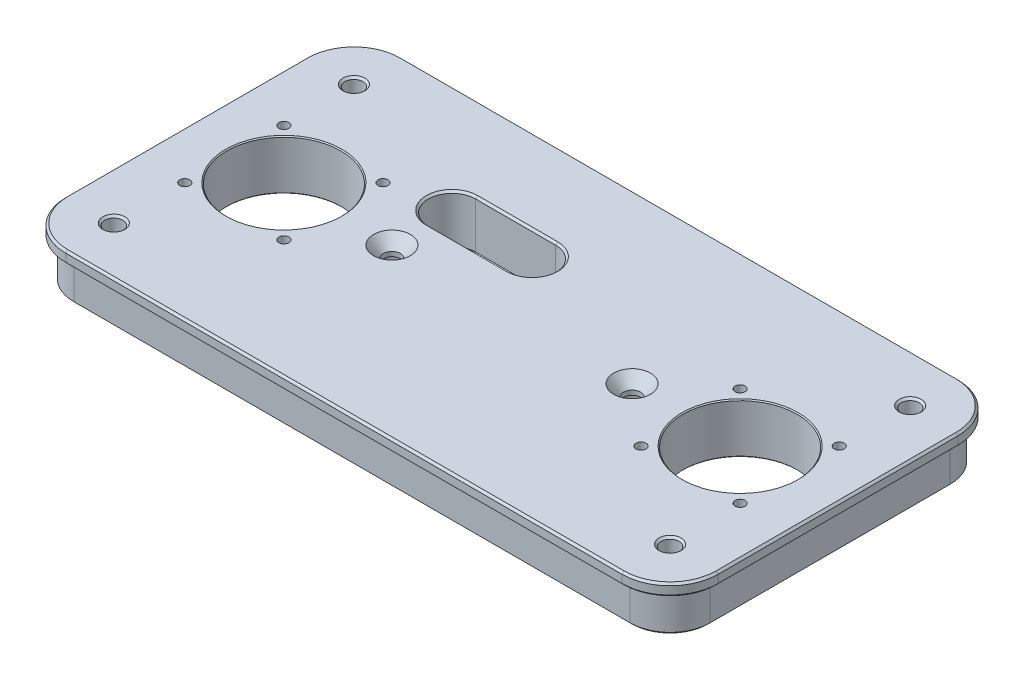
from build123d import *

# Parameters (mm, degrees)
SKETCH1_W                                            = 318
SKETCH1_H                                            = 160
BOSS_EXTRUDE1_DEPTH                                  = 25
SKETCH2_R                                            = 28.5
CUT_EXTRUDE1_DEPTH                                   = 180.738699228
CUT_EXTRUDE2_DEPTH                                   = 180.738699228
CUT_EXTRUDE2_DEPTH_BACK                              = 180.738699228
SKETCH4_R                                            = 9.55
CHAMFER1_SIZE                                        = 0.5
FILLET1_R                                            = 20
M8_CLEARANCE_HOLE1_D                                 = 9
M6X1_0_TAPPED_HOLE1_D                                = 5
SKETCH13_R                                           = 13.411040831
SKETCH13_R_2                                         = 14.724493856
BOSS_EXTRUDE3_DEPTH                                  = 8
CSK_FOR_5_16_FLAT_HEAD_SOCKET_CAP_SCREW1_D           = 8.4328
CSK_FOR_5_16_FLAT_HEAD_SOCKET_CAP_SCREW1_CSINK_D     = 18.4009792
CSK_FOR_5_16_FLAT_HEAD_SOCKET_CAP_SCREW1_CSINK_ANGLE = 82
BOSS_EXTRUDE4_DEPTH                                  = 6
CUT_EXTRUDE3_DEPTH                                   = 186.067555233
CHAMFER4_SIZE                                        = 1


with BuildPart() as part:
    # Sketch1 → Boss-Extrude1 (new body)
    with BuildSketch(Plane(origin=(0, 0, 0), x_dir=(1, 0, 0), z_dir=(0, 1, 0))):
        Rectangle(SKETCH1_W, SKETCH1_H)
    extrude(amount=BOSS_EXTRUDE1_DEPTH)

    # Sketch2 → Cut-Extrude1 (cut, through all)
    with BuildSketch(Plane(origin=(0, 25, 0), x_dir=(1, 0, 0), z_dir=(0, 1, 0))):
        with Locations((-114, 0)):
            Circle(SKETCH2_R)
        with Locations((114, 0)):
            Circle(SKETCH2_R)
    extrude(amount=-CUT_EXTRUDE1_DEPTH, mode=Mode.SUBTRACT)

    # Sketch4 → Cut-Extrude2 (cut, two sides: drawn at the far end of the back side and taken through both)
    with BuildSketch(Plane(origin=(0, 25, 0), x_dir=(1, 0, 0), z_dir=(0, 1, 0)).offset(-CUT_EXTRUDE2_DEPTH_BACK)):
        with Locations((-60, 0)):
            Circle(SKETCH4_R)
        with Locations((60, 0)):
            Circle(SKETCH4_R)
    extrude(amount=CUT_EXTRUDE2_DEPTH + CUT_EXTRUDE2_DEPTH_BACK, mode=Mode.SUBTRACT)

    # Chamfer1
    chamfer1_edges = [part.edges().sort_by_distance(p)[0] for p in [
        (85.5, 25, 0),
        (85.5, 0, 0),
        (50.45, 25, 0),
        (50.45, 0, 0),
        (-69.55, 25, 0),
        (-69.55, 0, 0),
        (-142.5, 25, 0),
        (-142.5, 0, 0),
    ]]
    chamfer(chamfer1_edges, length=CHAMFER1_SIZE)

    # Fillet1
    fillet1_edges = [part.edges().sort_by_distance(p)[0] for p in [
        (159, 12.5, 80),
        (159, 12.5, -80),
        (-159, 12.5, -80),
        (-159, 12.5, 80),
    ]]
    fillet(fillet1_edges, radius=FILLET1_R)

    # M8 Clearance Hole1 (through all)
    with Locations(Plane.XZ):
        with Locations((-139, -60), (-139, 60), (139, -60), (139, 60)):
            Hole(M8_CLEARANCE_HOLE1_D / 2)

    # M6x1.0 Tapped Hole1 (through all)
    with Locations(Plane(origin=(0, 0, 0), x_dir=(-1, 0, 0), z_dir=(0, -1, 0))):
        with Locations((138.765, -24.765), (89.235, -24.765), (89.235, 24.765), (138.765, 24.765), (-89.235, -24.765), (-138.765, -24.765), (-89.235, 24.765), (-138.765, 24.765)):
            Hole(M6X1_0_TAPPED_HOLE1_D / 2)

    # Sketch13 → Boss-Extrude3 (add)
    with BuildSketch(Plane(origin=(0, 25, 0), x_dir=(1, 0, 0), z_dir=(0, 1, 0))):
        with Locations((60, 0)):
            Circle(SKETCH13_R)
        with Locations((-60, 0)):
            Circle(SKETCH13_R_2)
    extrude(amount=-BOSS_EXTRUDE3_DEPTH)

    # CSK for 5/16 Flat Head Socket Cap Screw1 (through all)
    with Locations(Plane(origin=(0, 25, 0), x_dir=(1, 0, 0), z_dir=(0, 1, 0))):
        with Locations((60, 0), (-60, 0)):
            CounterSinkHole(CSK_FOR_5_16_FLAT_HEAD_SOCKET_CAP_SCREW1_D / 2, CSK_FOR_5_16_FLAT_HEAD_SOCKET_CAP_SCREW1_CSINK_D / 2, counter_sink_angle=CSK_FOR_5_16_FLAT_HEAD_SOCKET_CAP_SCREW1_CSINK_ANGLE)

    # Sketch16 → Boss-Extrude4 (add)
    with BuildSketch(Plane.XZ.offset(-25)):
        with BuildLine():
            Line((163, -60), (163, 60))
            ThreePointArc((163, 60), (155.970562748, 76.970562748), (139, 84))
            Line((139, 84), (-139, 84))
            ThreePointArc((-139, 84), (-155.970562748, 76.970562748), (-163, 60))
            Line((-163, 60), (-163, -60))
            ThreePointArc((-163, -60), (-155.970562748, -76.970562748), (-139, -84))
            Line((-139, -84), (139, -84))
            ThreePointArc((139, -84), (155.970562748, -76.970562748), (163, -60))
        make_face()
        with BuildLine():
            Line((159, 60), (159, -60))
            ThreePointArc((159, -60), (153.142135624, -74.142135624), (139, -80))
            Line((139, -80), (-139, -80))
            ThreePointArc((-139, -80), (-153.142135624, -74.142135624), (-159, -60))
            Line((-159, -60), (-159, 60))
            ThreePointArc((-159, 60), (-153.142135624, 74.142135624), (-139, 80))
            Line((-139, 80), (139, 80))
            ThreePointArc((139, 80), (153.142135624, 74.142135624), (159, 60))
        make_face(mode=Mode.SUBTRACT)
    extrude(amount=BOSS_EXTRUDE4_DEPTH)

    # Sketch17 → Cut-Extrude3 (cut, through all)
    with BuildSketch(Plane.XZ):
        with BuildLine():
            Line((-60, -18.184097247), (-20, -18.184097247))
            ThreePointArc((-20, -18.184097247), (-8.164859361, -30.019237886), (-20, -41.854378525))
            Line((-20, -41.854378525), (-60, -41.854378525))
            ThreePointArc((-60, -41.854378525), (-71.835140639, -30.019237886), (-60, -18.184097247))
        make_face()
    extrude(amount=-CUT_EXTRUDE3_DEPTH, mode=Mode.SUBTRACT)

    # Chamfer4
    chamfer4_edges = [part.edges().sort_by_distance(p)[0] for p in [
        (143.5, 0, -60),
        (143.5, 25, -60),
        (-134.5, 0, -60),
        (-134.5, 25, -60),
        (143.5, 0, 60),
        (143.5, 25, 60),
        (-134.5, 0, 60),
        (-134.5, 25, 60),
        (0, 19, -84),
        (155.970562748, 19, -76.970562748),
        (-155.970562748, 19, -76.970562748),
        (163, 19, 0),
        (-163, 19, 0),
        (155.970562748, 19, 76.970562748),
        (-155.970562748, 19, 76.970562748),
        (0, 19, 84),
        (0, 25, -84),
        (155.970562748, 25, -76.970562748),
        (-155.970562748, 25, -76.970562748),
        (163, 25, 0),
        (-163, 25, 0),
        (155.970562748, 25, 76.970562748),
        (-155.970562748, 25, 76.970562748),
        (0, 25, 84),
        (-40, 25, -18.184097247),
        (-71.835140639, 25, -30.019237886),
        (-8.164859361, 25, -30.019237886),
        (-40, 25, -41.854378525),
        (-40, 0, -18.184097247),
        (-71.835140639, 0, -30.019237886),
        (-8.164859361, 0, -30.019237886),
        (-40, 0, -41.854378525),
        (0, 0, -80),
        (-153.142135624, 0, -74.142135624),
        (153.142135624, 0, -74.142135624),
        (-159, 0, 0),
        (159, 0, 0),
        (-153.142135624, 0, 74.142135624),
        (153.142135624, 0, 74.142135624),
        (0, 0, 80),
    ]]
    chamfer(chamfer4_edges, length=CHAMFER4_SIZE)


solid = part.part
